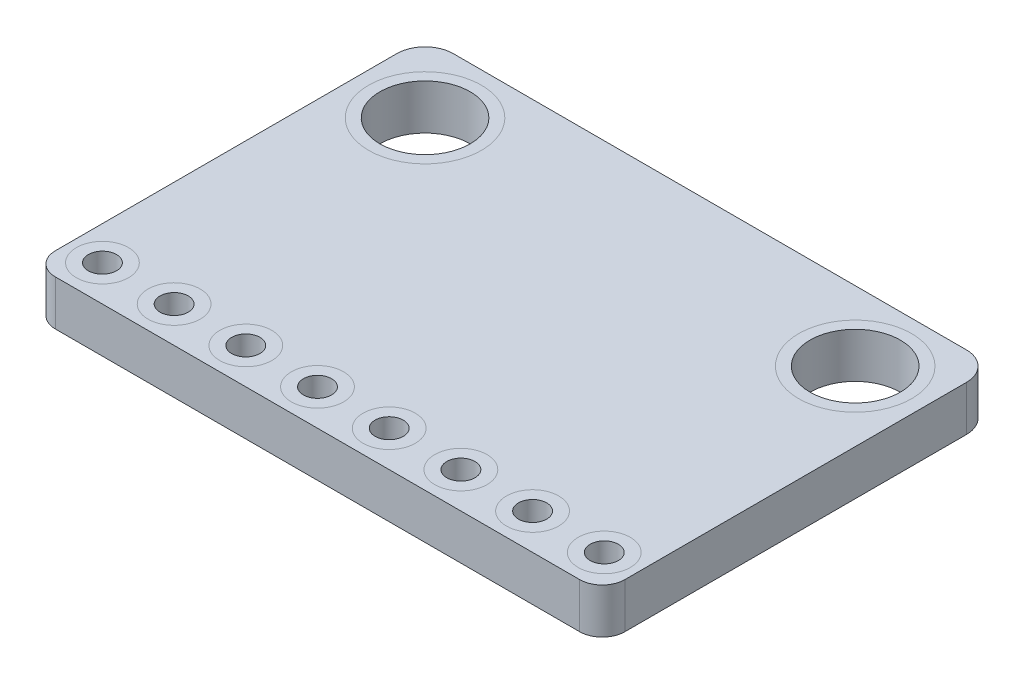
from build123d import *

# Parameters (mm, degrees)
SKETCH1_R             = 0.5
SKETCH1_R_2           = 1.6
BOSS_EXTRUDE1_DEPTH   = 1.6
SPLIT1_OUTLINE_R      = 2
SPLIT1_OUTLINE_R_2    = 1.6
SPLIT1_DEPTH          = 1.6
SPLIT1_2_OUTLINE_R    = 2
SPLIT1_2_OUTLINE_R_2  = 1.6
SPLIT1_2_DEPTH        = 1.6
SPLIT1_3_OUTLINE_R    = 0.925
SPLIT1_3_OUTLINE_R_2  = 0.5
SPLIT1_3_DEPTH        = 1.6
SPLIT1_4_OUTLINE_R    = 0.925
SPLIT1_4_OUTLINE_R_2  = 0.5
SPLIT1_4_DEPTH        = 1.6
SPLIT1_5_OUTLINE_R    = 0.925
SPLIT1_5_OUTLINE_R_2  = 0.5
SPLIT1_5_DEPTH        = 1.6
SPLIT1_6_OUTLINE_R    = 0.925
SPLIT1_6_OUTLINE_R_2  = 0.5
SPLIT1_6_DEPTH        = 1.6
SPLIT1_7_OUTLINE_R    = 0.925
SPLIT1_7_OUTLINE_R_2  = 0.5
SPLIT1_7_DEPTH        = 1.6
SPLIT1_8_OUTLINE_R    = 0.925
SPLIT1_8_OUTLINE_R_2  = 0.5
SPLIT1_8_DEPTH        = 1.6
SPLIT1_9_OUTLINE_R    = 0.925
SPLIT1_9_OUTLINE_R_2  = 0.5
SPLIT1_9_DEPTH        = 1.6
SPLIT1_10_OUTLINE_R   = 0.925
SPLIT1_10_OUTLINE_R_2 = 0.5
SPLIT1_10_DEPTH       = 1.6
SPLIT1_11_OUTLINE_R   = 2
SPLIT1_11_OUTLINE_R_2 = 1.6
SPLIT1_11_OUTLINE_R_3 = 0.925
SPLIT1_11_OUTLINE_R_4 = 0.5
SPLIT1_11_DEPTH       = 1.6


# Read off the part's stored shape, not the designer's step: Split1
with BuildPart() as part:
    # Sketch1 → Boss-Extrude1 (new body)
    with BuildSketch(Plane(origin=(0, 0, 0), x_dir=(1, 0, 0), z_dir=(0, 1, 0))):
        with BuildLine():
            Line((-0.4, -1.27), (18.18, -1.27))
            ThreePointArc((18.18, -1.27), (18.745685425, -1.035685425), (18.98, -0.47))
            Line((18.98, -0.47), (18.98, 11.63))
            ThreePointArc((18.98, 11.63), (18.687106781, 12.337106781), (17.98, 12.63))
            Line((17.98, 12.63), (-0.2, 12.63))
            ThreePointArc((-0.2, 12.63), (-0.907106781, 12.337106781), (-1.2, 11.63))
            Line((-1.2, 11.63), (-1.2, -0.47))
            ThreePointArc((-1.2, -0.47), (-0.965685425, -1.035685425), (-0.4, -1.27))
        make_face()
        with Locations(Location((0, 0, 0), (0, 0, 270))):
            Circle(SKETCH1_R, mode=Mode.SUBTRACT)
        with Locations(Location((2.54, 0, 0), (0, 0, 270))):
            Circle(SKETCH1_R, mode=Mode.SUBTRACT)
        with Locations(Location((5.08, 0, 0), (0, 0, 270))):
            Circle(SKETCH1_R, mode=Mode.SUBTRACT)
        with Locations(Location((7.62, 0, 0), (0, 0, 270))):
            Circle(SKETCH1_R, mode=Mode.SUBTRACT)
        with Locations(Location((10.16, 0, 0), (0, 0, 270))):
            Circle(SKETCH1_R, mode=Mode.SUBTRACT)
        with Locations(Location((12.7, 0, 0), (0, 0, 270))):
            Circle(SKETCH1_R, mode=Mode.SUBTRACT)
        with Locations(Location((15.24, 0, 0), (0, 0, 270))):
            Circle(SKETCH1_R, mode=Mode.SUBTRACT)
        with Locations(Location((17.78, 0, 0), (0, 0, 270))):
            Circle(SKETCH1_R, mode=Mode.SUBTRACT)
        with Locations(Location((1.27, 10.16, 0), (0, 0, 270))):
            Circle(SKETCH1_R_2, mode=Mode.SUBTRACT)
        with Locations(Location((16.51, 10.16, 0), (0, 0, 270))):
            Circle(SKETCH1_R_2, mode=Mode.SUBTRACT)
    extrude(amount=BOSS_EXTRUDE1_DEPTH)

    # Split1 11 outline → Split1 11 (cut)
    # profile 1 of 10: a face of its own
    with BuildSketch(Plane(origin=(0, 0, 0), x_dir=(1, 0, 0), z_dir=(0, 1, 0))):
        with Locations((1.27, 10.16)):
            Circle(SPLIT1_11_OUTLINE_R)
        with Locations((1.27, 10.16)):
            Circle(SPLIT1_11_OUTLINE_R_2, mode=Mode.SUBTRACT)
    # profile 2 of 10: a face of its own
    with BuildSketch(Plane(origin=(0, 0, 0), x_dir=(1, 0, 0), z_dir=(0, 1, 0))):
        with Locations((16.51, 10.16)):
            Circle(SPLIT1_11_OUTLINE_R)
        with Locations((16.51, 10.16)):
            Circle(SPLIT1_11_OUTLINE_R_2, mode=Mode.SUBTRACT)
    # profile 3 of 10: a face of its own
    with BuildSketch(Plane(origin=(0, 0, 0), x_dir=(1, 0, 0), z_dir=(0, 1, 0))):
        Circle(SPLIT1_11_OUTLINE_R_3)
        Circle(SPLIT1_11_OUTLINE_R_4, mode=Mode.SUBTRACT)
    # profile 4 of 10: a face of its own
    with BuildSketch(Plane(origin=(0, 0, 0), x_dir=(1, 0, 0), z_dir=(0, 1, 0))):
        with Locations((2.54, 0)):
            Circle(SPLIT1_11_OUTLINE_R_3)
        with Locations((2.54, 0)):
            Circle(SPLIT1_11_OUTLINE_R_4, mode=Mode.SUBTRACT)
    # profile 5 of 10: a face of its own
    with BuildSketch(Plane(origin=(0, 0, 0), x_dir=(1, 0, 0), z_dir=(0, 1, 0))):
        with Locations((5.08, 0)):
            Circle(SPLIT1_11_OUTLINE_R_3)
        with Locations((5.08, 0)):
            Circle(SPLIT1_11_OUTLINE_R_4, mode=Mode.SUBTRACT)
    # profile 6 of 10: a face of its own
    with BuildSketch(Plane(origin=(0, 0, 0), x_dir=(1, 0, 0), z_dir=(0, 1, 0))):
        with Locations((7.62, 0)):
            Circle(SPLIT1_11_OUTLINE_R_3)
        with Locations((7.62, 0)):
            Circle(SPLIT1_11_OUTLINE_R_4, mode=Mode.SUBTRACT)
    # profile 7 of 10: a face of its own
    with BuildSketch(Plane(origin=(0, 0, 0), x_dir=(1, 0, 0), z_dir=(0, 1, 0))):
        with Locations((10.16, 0)):
            Circle(SPLIT1_11_OUTLINE_R_3)
        with Locations((10.16, 0)):
            Circle(SPLIT1_11_OUTLINE_R_4, mode=Mode.SUBTRACT)
    # profile 8 of 10: a face of its own
    with BuildSketch(Plane(origin=(0, 0, 0), x_dir=(1, 0, 0), z_dir=(0, 1, 0))):
        with Locations((12.7, 0)):
            Circle(SPLIT1_11_OUTLINE_R_3)
        with Locations((12.7, 0)):
            Circle(SPLIT1_11_OUTLINE_R_4, mode=Mode.SUBTRACT)
    # profile 9 of 10: a face of its own
    with BuildSketch(Plane(origin=(0, 0, 0), x_dir=(1, 0, 0), z_dir=(0, 1, 0))):
        with Locations((15.24, 0)):
            Circle(SPLIT1_11_OUTLINE_R_3)
        with Locations((15.24, 0)):
            Circle(SPLIT1_11_OUTLINE_R_4, mode=Mode.SUBTRACT)
    # profile 10 of 10: a face of its own
    with BuildSketch(Plane(origin=(0, 0, 0), x_dir=(1, 0, 0), z_dir=(0, 1, 0))):
        with Locations((17.78, 0)):
            Circle(SPLIT1_11_OUTLINE_R_3)
        with Locations((17.78, 0)):
            Circle(SPLIT1_11_OUTLINE_R_4, mode=Mode.SUBTRACT)
    extrude(amount=SPLIT1_11_DEPTH, mode=Mode.SUBTRACT)


with BuildPart() as body_2:
    # Split1 outline → Split1 (new body)
    with BuildSketch(Plane(origin=(0, 0, 0), x_dir=(1, 0, 0), z_dir=(0, 1, 0))):
        with Locations((1.27, 10.16)):
            Circle(SPLIT1_OUTLINE_R)
        with Locations((1.27, 10.16)):
            Circle(SPLIT1_OUTLINE_R_2, mode=Mode.SUBTRACT)
    extrude(amount=SPLIT1_DEPTH)


with BuildPart() as body_3:
    # Split1 2 outline → Split1 2 (new body)
    with BuildSketch(Plane(origin=(0, 0, 0), x_dir=(1, 0, 0), z_dir=(0, 1, 0))):
        with Locations((16.51, 10.16)):
            Circle(SPLIT1_2_OUTLINE_R)
        with Locations((16.51, 10.16)):
            Circle(SPLIT1_2_OUTLINE_R_2, mode=Mode.SUBTRACT)
    extrude(amount=SPLIT1_2_DEPTH)


with BuildPart() as body_4:
    # Split1 3 outline → Split1 3 (new body)
    with BuildSketch(Plane(origin=(0, 0, 0), x_dir=(1, 0, 0), z_dir=(0, 1, 0))):
        Circle(SPLIT1_3_OUTLINE_R)
        Circle(SPLIT1_3_OUTLINE_R_2, mode=Mode.SUBTRACT)
    extrude(amount=SPLIT1_3_DEPTH)


with BuildPart() as body_5:
    # Split1 4 outline → Split1 4 (new body)
    with BuildSketch(Plane(origin=(0, 0, 0), x_dir=(1, 0, 0), z_dir=(0, 1, 0))):
        with Locations((2.54, 0)):
            Circle(SPLIT1_4_OUTLINE_R)
        with Locations((2.54, 0)):
            Circle(SPLIT1_4_OUTLINE_R_2, mode=Mode.SUBTRACT)
    extrude(amount=SPLIT1_4_DEPTH)


with BuildPart() as body_6:
    # Split1 5 outline → Split1 5 (new body)
    with BuildSketch(Plane(origin=(0, 0, 0), x_dir=(1, 0, 0), z_dir=(0, 1, 0))):
        with Locations((5.08, 0)):
            Circle(SPLIT1_5_OUTLINE_R)
        with Locations((5.08, 0)):
            Circle(SPLIT1_5_OUTLINE_R_2, mode=Mode.SUBTRACT)
    extrude(amount=SPLIT1_5_DEPTH)


with BuildPart() as body_7:
    # Split1 6 outline → Split1 6 (new body)
    with BuildSketch(Plane(origin=(0, 0, 0), x_dir=(1, 0, 0), z_dir=(0, 1, 0))):
        with Locations((7.62, 0)):
            Circle(SPLIT1_6_OUTLINE_R)
        with Locations((7.62, 0)):
            Circle(SPLIT1_6_OUTLINE_R_2, mode=Mode.SUBTRACT)
    extrude(amount=SPLIT1_6_DEPTH)


with BuildPart() as body_8:
    # Split1 7 outline → Split1 7 (new body)
    with BuildSketch(Plane(origin=(0, 0, 0), x_dir=(1, 0, 0), z_dir=(0, 1, 0))):
        with Locations((10.16, 0)):
            Circle(SPLIT1_7_OUTLINE_R)
        with Locations((10.16, 0)):
            Circle(SPLIT1_7_OUTLINE_R_2, mode=Mode.SUBTRACT)
    extrude(amount=SPLIT1_7_DEPTH)


with BuildPart() as body_9:
    # Split1 8 outline → Split1 8 (new body)
    with BuildSketch(Plane(origin=(0, 0, 0), x_dir=(1, 0, 0), z_dir=(0, 1, 0))):
        with Locations((12.7, 0)):
            Circle(SPLIT1_8_OUTLINE_R)
        with Locations((12.7, 0)):
            Circle(SPLIT1_8_OUTLINE_R_2, mode=Mode.SUBTRACT)
    extrude(amount=SPLIT1_8_DEPTH)


with BuildPart() as body_10:
    # Split1 9 outline → Split1 9 (new body)
    with BuildSketch(Plane(origin=(0, 0, 0), x_dir=(1, 0, 0), z_dir=(0, 1, 0))):
        with Locations((15.24, 0)):
            Circle(SPLIT1_9_OUTLINE_R)
        with Locations((15.24, 0)):
            Circle(SPLIT1_9_OUTLINE_R_2, mode=Mode.SUBTRACT)
    extrude(amount=SPLIT1_9_DEPTH)


with BuildPart() as body_11:
    # Split1 10 outline → Split1 10 (new body)
    with BuildSketch(Plane(origin=(0, 0, 0), x_dir=(1, 0, 0), z_dir=(0, 1, 0))):
        with Locations((17.78, 0)):
            Circle(SPLIT1_10_OUTLINE_R)
        with Locations((17.78, 0)):
            Circle(SPLIT1_10_OUTLINE_R_2, mode=Mode.SUBTRACT)
    extrude(amount=SPLIT1_10_DEPTH)


solid = Compound([part.part, body_2.part, body_3.part, body_4.part, body_5.part, body_6.part, body_7.part, body_8.part, body_9.part, body_10.part, body_11.part])
